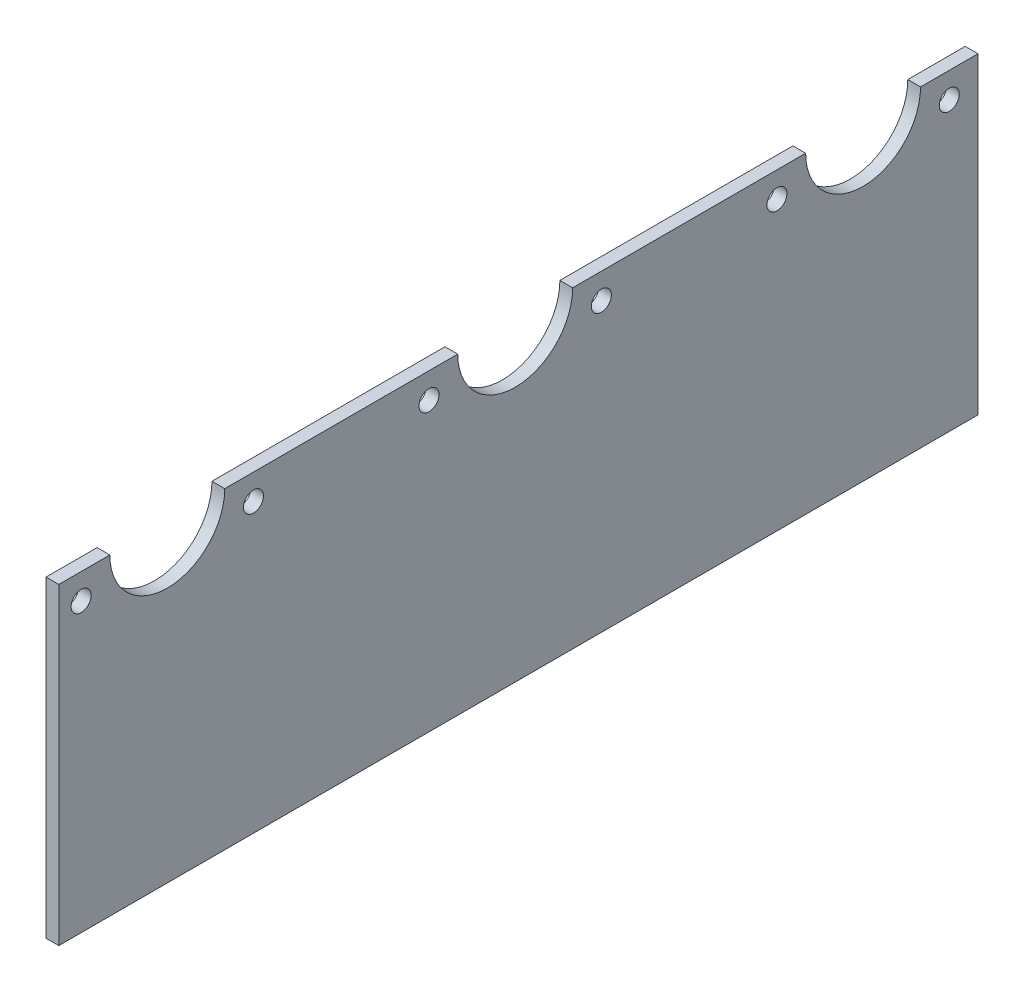
from build123d import *

# Parameters (mm, degrees)
BOSS_EXTRUDE1_DEPTH    = 3.175
F_10_CLEARANCE_HOLE1_D = 4.9784


with BuildPart() as part:
    # Sketch1 → Boss-Extrude1 (new body)
    with BuildSketch(Plane(origin=(0, 0, 0), x_dir=(0, 0, -1), z_dir=(1, 0, 0))):
        with BuildLine():
            Line((114.3, 0), (-114.3, 0))
            Line((-114.3, 0), (-114.3, 77.7875))
            Line((-114.3, 77.7875), (-101.6, 77.7875))
            ThreePointArc((-101.6, 77.7875), (-87.3125, 63.5), (-73.025, 77.7875))
            Line((-73.025, 77.7875), (-15.08125, 77.7875))
            ThreePointArc((-15.08125, 77.7875), (-0.79375, 63.5), (13.49375, 77.7875))
            Line((13.49375, 77.7875), (71.4375, 77.7875))
            ThreePointArc((71.4375, 77.7875), (85.725, 63.5), (100.0125, 77.7875))
            Line((100.0125, 77.7875), (114.3, 77.7875))
            Line((114.3, 77.7875), (114.3, 0))
        make_face()
    extrude(amount=BOSS_EXTRUDE1_DEPTH)

    # #10 Clearance Hole1 (through all)
    with Locations(Plane(origin=(3.175, 0, 0), x_dir=(0, 0, -1), z_dir=(1, 0, 0))):
        with Locations((-108.74375, 71.4375), (-65.88125, 71.4375), (-22.225, 71.4375), (20.6375, 71.4375), (64.29375, 71.4375), (107.15625, 71.4375)):
            Hole(F_10_CLEARANCE_HOLE1_D / 2)


solid = part.part
